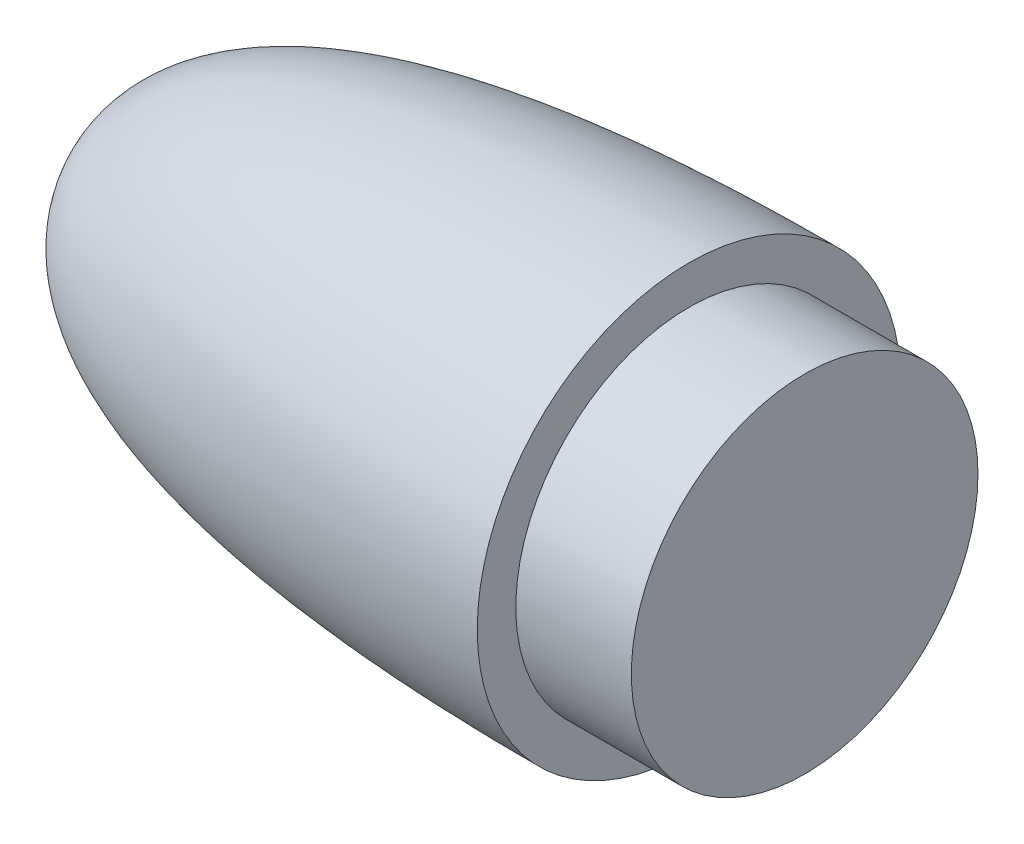
from build123d import *


with BuildPart() as part:
    # Sketch1 → Revolve2 (revolve)
    with BuildSketch(Plane(origin=(0, 0, 0), x_dir=(1, 0, 0), z_dir=(0, 1, 0))):
        with BuildLine():
            Line((-91.2, 22.5), (0, 22.5))
            Line((0, 22.5), (0, 45))
            Line((0, 45), (-15, 45))
            Line((-15, 45), (-15, 50))
            add(Edge.make_bspline(
                [(-15, 50), (-91.2, 50), (-91.2, 22.5)],
                knots=[0, 0, 0, 1, 1, 1], degree=2))
        make_face()
    revolve(axis=Axis((-15, 0, -22.5), (-1, 0, 0)))


solid = part.part
